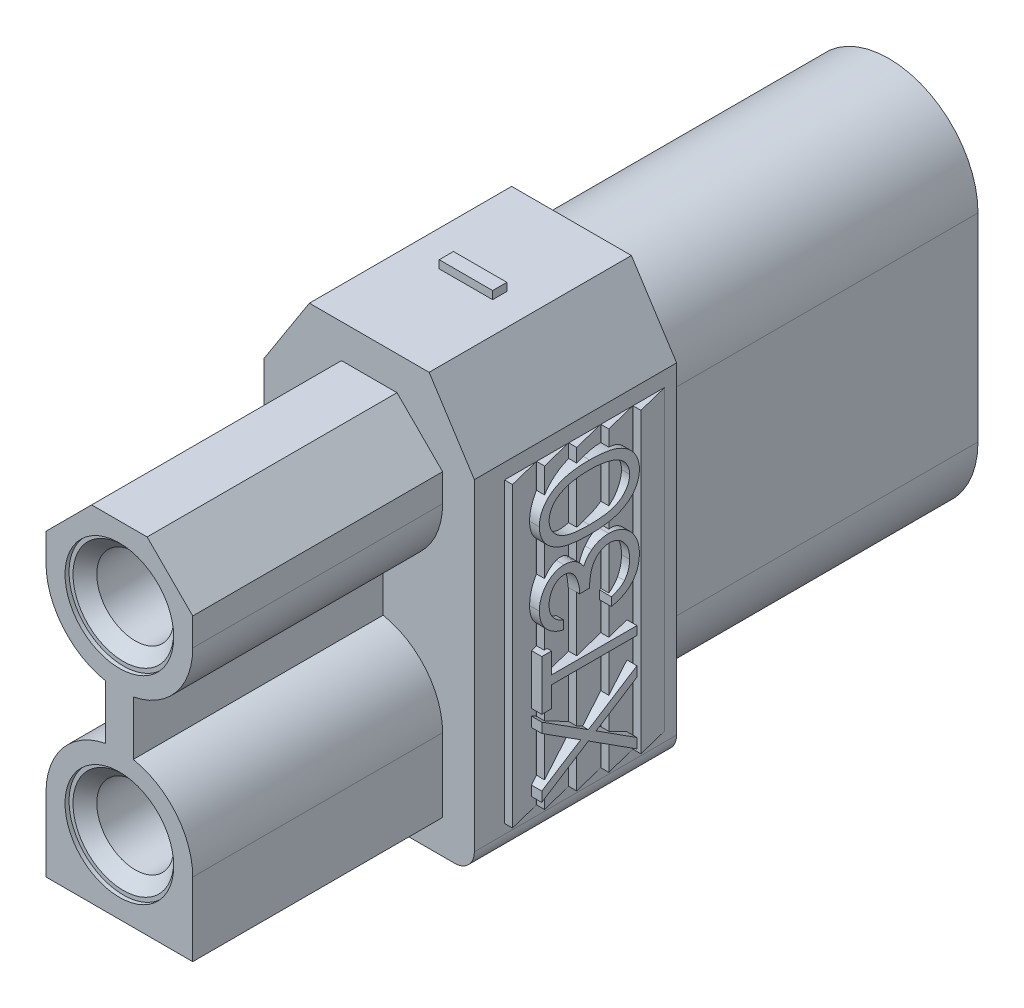
from build123d import *

# Parameters (mm, degrees)
BOSS_EXTRUDE2_DEPTH        = 5.1
BOSS_EXTRUDE3_START        = 1.45
BOSS_EXTRUDE3_DEPTH        = 3.65
BOSS_EXTRUDE4_START        = 1
BOSS_EXTRUDE4_DEPTH        = 7.5
BOSS_EXTRUDE5_DEPTH        = 5.1
BOSS_EXTRUDE5_DEPTH_BACK   = 3.45
SKETCH7_R                  = 1.1
BOSS_EXTRUDE5_2_DEPTH      = 5.1
BOSS_EXTRUDE5_2_DEPTH_BACK = 3.45
SKETCH8_R                  = 0.65
CUT_EXTRUDE1_DEPTH         = 3
CUT_EXTRUDE2_DEPTH         = 13.156309846
CUT_EXTRUDE2_DEPTH_BACK    = 13.156309846
SKETCH9_W                  = 1.9
SKETCH9_H                  = 1.1
SKETCH9_W_2                = 1.75
CHAMFER1_SIZE              = 0.65
CHAMFER3_SIZE              = 0.65
SKETCH10_R                 = 1.37
SKETCH10_R_2               = 0.97
BOSS_EXTRUDE6_DEPTH        = 6.2
BOSS_EXTRUDE6_2_DEPTH      = 6.2
BOSS_EXTRUDE7_DEPTH        = 0.2
SKETCH13_W                 = 1.346153847
SKETCH13_H                 = 0.358974359
BOSS_EXTRUDE8_DEPTH        = 0.2
BOSS_EXTRUDE9_DEPTH        = 0.3
BOSS_EXTRUDE10_DEPTH       = 0.3
CHAMFER4_SIZE              = 0.3
CHAMFER5_SIZE              = 0.3
SKETCH17_R                 = 1.37
BOSS_EXTRUDE11_DEPTH       = 6.3
BOSS_EXTRUDE11_2_DEPTH     = 6.3
SKETCH18_W                 = 0.7
SKETCH18_H                 = 1.720139453
BOSS_EXTRUDE12_DEPTH       = 6.3
BOSS_EXTRUDE13_DEPTH       = 8


with BuildPart() as part:
    # Sketch3 → Boss-Extrude2 (new body)
    with BuildSketch(Plane.XY):
        with BuildLine():
            Line((2.15, 0.260364397), (-2.15, 0.260364397))
            ThreePointArc((-2.15, 0.260364397), (-2.503553391, 0.406811006), (-2.65, 0.760364397))
            Line((-2.65, 0.760364397), (-2.65, 8.886196367))
            Line((-2.65, 8.886196367), (-1.509463409, 10.660364397))
            Line((-1.509463409, 10.660364397), (1.509463409, 10.660364397))
            Line((1.509463409, 10.660364397), (2.65, 8.886196367))
            Line((2.65, 8.886196367), (2.65, 0.760364397))
            ThreePointArc((2.65, 0.760364397), (2.503553391, 0.406811006), (2.15, 0.260364397))
        make_face()
        Polygon((1.9, 1.010364397), (-1.9, 1.010364397), (-1.9, 8.665919952), (-1.1, 9.910364397), (1.1, 9.910364397), (1.9, 8.665919952), align=None, mode=Mode.SUBTRACT)
    extrude(amount=BOSS_EXTRUDE2_DEPTH)

    # Sketch4 → Boss-Extrude3 (add)
    with BuildSketch(Plane.XY.offset(BOSS_EXTRUDE3_START)):
        with BuildLine():
            Line((-1.5, 10.010364397), (1.4, 10.010364397))
            ThreePointArc((1.4, 10.010364397), (1.753553391, 9.863917787), (1.9, 9.510364397))
            Line((1.9, 9.510364397), (1.9, 1.010364397))
            Line((1.9, 1.010364397), (-2, 1.010364397))
            Line((-2, 1.010364397), (-2, 9.510364397))
            ThreePointArc((-2, 9.510364397), (-1.853553391, 9.863917787), (-1.5, 10.010364397))
        make_face()
    extrude(amount=BOSS_EXTRUDE3_DEPTH)

    # Sketch6 → Boss-Extrude4 (add)
    with BuildSketch(Plane(origin=(0, 0, 0), x_dir=(1, 0, 0), z_dir=(0, 1, 0)).offset(BOSS_EXTRUDE4_START)):
        Polygon((2.65, -0.3), (2.65, -1.1), (2.85, -1.1), align=None)
        Polygon((2.65, -1.11), (2.65, -1.91), (2.85, -1.91), align=None)
        Polygon((2.65, -1.92), (2.65, -2.72), (2.85, -2.72), align=None)
        Polygon((2.65, -2.73), (2.65, -3.53), (2.85, -3.53), align=None)
        Polygon((2.65, -3.54), (2.65, -4.34), (2.85, -4.34), align=None)
        Polygon((-2.85, -4.34), (-2.65, -3.54), (-2.65, -4.34), align=None)
        Polygon((-2.85, -3.53), (-2.65, -2.73), (-2.65, -3.53), align=None)
        Polygon((-2.85, -2.72), (-2.65, -1.92), (-2.65, -2.72), align=None)
        Polygon((-2.85, -1.91), (-2.65, -1.11), (-2.65, -1.91), align=None)
        Polygon((-2.85, -1.1), (-2.65, -0.3), (-2.65, -1.1), align=None)
    extrude(amount=BOSS_EXTRUDE4_DEPTH)

    # Sketch12 → Boss-Extrude7 (add)
    with BuildSketch(Plane.XZ.offset(-0.260364397)):
        Polygon((-0.148717949, 2.884615385), (-0.148717949, 3.916666667), (0.165384615, 3.916666667), (0.165384615, 2.884615385), (1.197435897, 2.884615385), (1.197435897, 2.570512821), (0.165384615, 2.570512821), (0.165384615, 1.538461538), (-0.148717949, 1.538461538), (-0.148717949, 2.570512821), (-1.180769231, 2.570512821), (-1.180769231, 2.884615385), align=None)
    extrude(amount=BOSS_EXTRUDE7_DEPTH)

    # Sketch13 → Boss-Extrude8 (add)
    with BuildSketch(Plane(origin=(0, 10.660364397, 0), x_dir=(-1, 0, 0), z_dir=(0, 1, 0))):
        with Locations((-0.052168047, 2.534824587)):
            Rectangle(SKETCH13_W, SKETCH13_H)
    extrude(amount=BOSS_EXTRUDE8_DEPTH)

    # Sketch14 → Boss-Extrude9 (add)
    # profile 1 of 4: a face of its own
    with BuildSketch(Plane.ZY.offset(2.65)):
        Polygon((3.7, 8.211538462), (3.7, 7.962980769), (2.718269231, 7.334615385), (3.7, 6.70625), (3.7, 6.457692308), (2.524038462, 7.210096154), (1.3, 6.426923077), (1.3, 6.675480769), (2.329807692, 7.334615385), (1.3, 7.99375), (1.3, 8.242307692), (2.524038462, 7.458653846), align=None)
    # profile 2 of 4: a face of its own
    with BuildSketch(Plane.ZY.offset(2.65)):
        Polygon((3.453846154, 6.288461538), (3.7, 6.288461538), (3.7, 5.026923077), (3.453846154, 5.026923077), (3.453846154, 5.55), (1.3, 5.55), (1.3, 5.765384615), (3.453846154, 5.765384615), align=None)
    # profile 3 of 4: a face of its own
    with BuildSketch(Plane.ZY.offset(2.65)):
        with BuildLine():
            Line((3.146153846, 4.503846154), (3.146153846, 4.719230769))
            add(Edge.make_bspline(
                [(3.146153846, 4.719230769), (3.170313264, 4.713395649), (3.217542949, 4.701988466), (3.285022214, 4.678195844), (3.348878343, 4.652276354), (3.40791565, 4.621152397), (3.463320612, 4.587203537), (3.513836583, 4.548307957), (3.560748331, 4.506260147), (3.602380265, 4.45975161), (3.64007928, 4.410977671), (3.672222176, 4.359251074), (3.699873024, 4.305612519), (3.722652611, 4.24969037), (3.73981297, 4.191318138), (3.752263351, 4.131023539), (3.760348687, 4.068648568), (3.761137781, 4.026307363), (3.761538462, 4.004807692)],
                knots=[0, 0, 0, 0, 1.162005537, 2.271625781, 3.343758855, 4.383309926, 5.390229558, 6.379919256, 7.361854164, 8.333198761, 9.295911338, 10.242430842, 11.177959212, 12.116337295, 13.062827104, 14.020064771, 14.994644689, 16, 16, 16, 16], degree=3))
            add(Edge.make_bspline(
                [(3.761538462, 4.004807692), (3.760592704, 3.973482383), (3.758721818, 3.911515062), (3.741637633, 3.820477544), (3.714603256, 3.732687725), (3.677249843, 3.649106526), (3.631178543, 3.57147103), (3.57634558, 3.502394787), (3.513808916, 3.442814094), (3.444735158, 3.392829378), (3.370914237, 3.353692236), (3.294936987, 3.324833008), (3.216983635, 3.307263856), (3.164350072, 3.304986903), (3.137980769, 3.303846154)],
                knots=[0, 0, 0, 0, 1.083050992, 2.142477498, 3.193116406, 4.255571735, 5.30263384, 6.308962982, 7.297363603, 8.282367274, 9.249857812, 10.179914175, 11.08814088, 12, 12, 12, 12], degree=3))
            add(Edge.make_bspline(
                [(3.137980769, 3.303846154), (3.112604681, 3.304644045), (3.062947616, 3.306205394), (2.990452875, 3.319462792), (2.922127206, 3.341773372), (2.85768298, 3.372678352), (2.797528805, 3.412683987), (2.741529337, 3.461145264), (2.689436199, 3.518404233), (2.659594275, 3.561795504), (2.644230769, 3.584134615)],
                knots=[0, 0, 0, 0, 1.024540389, 2.004866551, 2.965041327, 3.920577974, 4.882998113, 5.874504559, 6.905732034, 8, 8, 8, 8], degree=3))
            add(Edge.make_bspline(
                [(2.644230769, 3.584134615), (2.63190288, 3.558604269), (2.607477766, 3.50802127), (2.559576676, 3.439072335), (2.504269466, 3.376481792), (2.46110879, 3.341576385), (2.439423077, 3.324038462)],
                knots=[0, 0, 0, 0, 1.015518401, 2.012035669, 3.001164323, 4, 4, 4, 4], degree=3))
            add(Edge.make_bspline(
                [(2.439423077, 3.324038462), (2.423613732, 3.312485412), (2.392253932, 3.289568501), (2.341804337, 3.261361383), (2.290962579, 3.235479451), (2.237729623, 3.216431099), (2.183815408, 3.199993125), (2.128065414, 3.189177486), (2.071009313, 3.182234278), (2.032392143, 3.18125931), (2.012980769, 3.180769231)],
                knots=[0, 0, 0, 0, 1.02516404, 2.033540309, 3.025129118, 4.011046665, 4.991655828, 5.976607087, 6.982917762, 8, 8, 8, 8], degree=3))
            add(Edge.make_bspline(
                [(2.012980769, 3.180769231), (1.97937544, 3.182002464), (1.912322928, 3.184463127), (1.813234502, 3.206368134), (1.716541423, 3.240522701), (1.623676369, 3.288177011), (1.536970145, 3.347137911), (1.45974361, 3.417672544), (1.39291464, 3.498066224), (1.33725751, 3.587792791), (1.292734208, 3.684961717), (1.261839895, 3.788901588), (1.241716319, 3.898100993), (1.239558549, 3.972986084), (1.238461538, 4.011057692)],
                knots=[0, 0, 0, 0, 0.95570045, 1.906903359, 2.87519758, 3.868912786, 4.869932978, 5.851730567, 6.836639976, 7.83677598, 8.849487602, 9.869908895, 10.917060885, 12, 12, 12, 12], degree=3))
            add(Edge.make_bspline(
                [(1.238461538, 4.011057692), (1.239056885, 4.036716641), (1.240228328, 4.087204896), (1.248236511, 4.161429009), (1.262862801, 4.232278174), (1.282545067, 4.299848184), (1.307499405, 4.364199066), (1.338575083, 4.425134453), (1.375131542, 4.483029237), (1.417600288, 4.537337089), (1.465107492, 4.588051536), (1.518496527, 4.633824832), (1.576780462, 4.675420119), (1.640636272, 4.711723643), (1.709238734, 4.744388981), (1.783466275, 4.771255923), (1.862655319, 4.79490317), (1.917840055, 4.805897546), (1.946153846, 4.811538462)],
                knots=[0, 0, 0, 0, 1.048658725, 2.063410685, 3.046034179, 4.001477787, 4.936774919, 5.862367409, 6.792675028, 7.730719943, 8.675894397, 9.627829632, 10.600096036, 11.597688215, 12.626045268, 13.701542398, 14.82072376, 16, 16, 16, 16], degree=3))
            Line((1.946153846, 4.811538462), (1.946153846, 4.596153846))
            add(Edge.make_bspline(
                [(1.946153846, 4.596153846), (1.927674523, 4.590542446), (1.891730634, 4.579627786), (1.840000138, 4.561048839), (1.792577473, 4.539882024), (1.749114761, 4.517174898), (1.709183971, 4.493326821), (1.673840975, 4.466642301), (1.641533408, 4.439097744), (1.623331388, 4.418334759), (1.614423077, 4.408173077)],
                knots=[0, 0, 0, 0, 1.198163088, 2.33053128, 3.407730985, 4.417276592, 5.372219308, 6.28897303, 7.162600585, 8, 8, 8, 8], degree=3))
            add(Edge.make_bspline(
                [(1.614423077, 4.408173077), (1.604063077, 4.394735424), (1.583375055, 4.367901598), (1.556973938, 4.324174811), (1.534097806, 4.278187461), (1.516623272, 4.228943113), (1.501827162, 4.177504413), (1.49214452, 4.123039934), (1.485501203, 4.066030185), (1.484914964, 4.027103719), (1.484615385, 4.007211538)],
                knots=[0, 0, 0, 0, 0.946170439, 1.889420265, 2.845303464, 3.807233317, 4.801018734, 5.828864929, 6.890507805, 8, 8, 8, 8], degree=3))
            add(Edge.make_bspline(
                [(1.484615385, 4.007211538), (1.485037033, 3.98475169), (1.485861529, 3.940833395), (1.493465896, 3.87675431), (1.504492464, 3.815774027), (1.521740161, 3.758514848), (1.542431622, 3.704197617), (1.569520542, 3.654034852), (1.600113099, 3.606551829), (1.635698125, 3.563139581), (1.674161687, 3.524001317), (1.714968099, 3.490181532), (1.756852096, 3.460889731), (1.800790747, 3.437344011), (1.846353049, 3.418718241), (1.893709543, 3.406046248), (1.942461457, 3.397233195), (1.975601388, 3.396515597), (1.992307692, 3.396153846)],
                knots=[0, 0, 0, 0, 1.216990249, 2.379719373, 3.493992396, 4.571561497, 5.616923107, 6.638958652, 7.655775068, 8.674704564, 9.676001865, 10.625896028, 11.54399481, 12.441854662, 13.322657739, 14.20572845, 15.095482574, 16, 16, 16, 16], degree=3))
            add(Edge.make_bspline(
                [(1.992307692, 3.396153846), (2.014669779, 3.397203177), (2.05928268, 3.399296618), (2.12491721, 3.415279923), (2.188157598, 3.441568341), (2.247915784, 3.478376614), (2.303327092, 3.523161948), (2.352574163, 3.575490823), (2.393618756, 3.635491603), (2.421872315, 3.691070581), (2.440702124, 3.740419384), (2.453905233, 3.782567182), (2.464459565, 3.829794668), (2.474668782, 3.881534884), (2.483227542, 3.938006046), (2.490395838, 3.99925903), (2.496122592, 4.065318479), (2.498681403, 4.111049473), (2.5, 4.134615385)],
                knots=[0, 0, 0, 0, 1.070481957, 2.135637345, 3.216366529, 4.339485895, 5.485746587, 6.620975969, 7.768829582, 8.956804399, 9.598399438, 10.297751078, 11.070570279, 11.915248466, 12.824061284, 13.805856426, 14.869322739, 16, 16, 16, 16], degree=3))
            Line((2.5, 4.134615385), (2.746153846, 4.134615385))
            add(Edge.make_bspline(
                [(2.746153846, 4.134615385), (2.746659909, 4.104923977), (2.74765116, 4.046765804), (2.759557156, 3.961798157), (2.776212077, 3.880451678), (2.801133952, 3.804583191), (2.831047314, 3.735657242), (2.864776815, 3.675530146), (2.902990827, 3.62562689), (2.945187826, 3.585822797), (2.990973089, 3.556608006), (3.038193773, 3.534679412), (3.087948546, 3.521823981), (3.121884535, 3.520098217), (3.138942308, 3.519230769)],
                knots=[0, 0, 0, 0, 1.321708579, 2.588902423, 3.815526512, 5.016621128, 6.138757764, 7.158873101, 8.079948563, 8.928590313, 9.728601868, 10.489025425, 11.240515403, 12, 12, 12, 12], degree=3))
            add(Edge.make_bspline(
                [(3.138942308, 3.519230769), (3.151475649, 3.519514904), (3.176410136, 3.520080176), (3.212838313, 3.527210223), (3.248154898, 3.537922039), (3.282199645, 3.552657938), (3.314774944, 3.572345731), (3.345920757, 3.59597764), (3.376159056, 3.623565073), (3.404043204, 3.655829025), (3.430345097, 3.690758195), (3.453082104, 3.728681243), (3.472353977, 3.768761731), (3.488276651, 3.811036515), (3.500246646, 3.855674947), (3.508843236, 3.902458453), (3.514217465, 3.951478695), (3.514991259, 3.984922153), (3.515384615, 4.001923077)],
                knots=[0, 0, 0, 0, 0.884317272, 1.759307272, 2.611736065, 3.488921043, 4.37244062, 5.294096728, 6.247679003, 7.258495569, 8.302441962, 9.333537773, 10.376747089, 11.440883505, 12.520330301, 13.637364711, 14.798958396, 16, 16, 16, 16], degree=3))
            add(Edge.make_bspline(
                [(3.515384615, 4.001923077), (3.514432389, 4.029250838), (3.51257247, 4.082628311), (3.496224619, 4.159563101), (3.470323134, 4.231010572), (3.439047168, 4.285439132), (3.408279997, 4.325699299), (3.381810999, 4.355020423), (3.351800577, 4.383288989), (3.317425578, 4.409395714), (3.27986802, 4.434904968), (3.238921049, 4.459573177), (3.194000885, 4.482607996), (3.162411731, 4.496629667), (3.146153846, 4.503846154)],
                knots=[0, 0, 0, 0, 1.4727372, 2.876598283, 4.222346151, 5.558423782, 6.24313385, 6.953189256, 7.68715613, 8.463578749, 9.278833271, 10.135787152, 11.040551781, 12, 12, 12, 12], degree=3))
        make_face()
    # profile 4 of 4: a face of its own
    with BuildSketch(Plane.ZY.offset(2.65)):
        with BuildLine():
            add(Edge.make_bspline(
                [(2.499038462, 2.965384615), (2.537505242, 2.965159689), (2.612227517, 2.964722765), (2.721108414, 2.959862134), (2.823252613, 2.951787614), (2.918664999, 2.940721985), (3.007370214, 2.927255947), (3.089131173, 2.909279594), (3.164326392, 2.888836595), (3.233200736, 2.865143267), (3.296683291, 2.838409551), (3.355943811, 2.809309064), (3.410907058, 2.776702805), (3.462398728, 2.742398603), (3.509844149, 2.705142892), (3.553153471, 2.665328627), (3.592352846, 2.622560867), (3.627908811, 2.577685461), (3.658882589, 2.530418809), (3.686792023, 2.482217984), (3.709699001, 2.432232443), (3.728521186, 2.380918072), (3.743602926, 2.328424096), (3.754047002, 2.274533615), (3.760592629, 2.219233611), (3.761220193, 2.181909617), (3.761538462, 2.162980769)],
                knots=[0, 0, 0, 0, 1.646377244, 3.198111528, 4.663803227, 6.031090796, 7.308794487, 8.502186765, 9.612154809, 10.642545331, 11.617106989, 12.558866172, 13.465886467, 14.35053239, 15.20542558, 16.045215227, 16.865619885, 17.686225247, 18.492864914, 19.282407821, 20.068097601, 20.842842034, 21.620163247, 22.403093475, 23.190129512, 24, 24, 24, 24], degree=3))
            add(Edge.make_bspline(
                [(3.761538462, 2.162980769), (3.76120396, 2.143893584), (3.760538741, 2.105935178), (3.75414518, 2.049816063), (3.74353641, 1.994993425), (3.728504885, 1.941700987), (3.709856421, 1.889500996), (3.686482397, 1.838801745), (3.659274031, 1.789288317), (3.627303373, 1.741747549), (3.591658383, 1.695657527), (3.551363982, 1.652150352), (3.506827031, 1.611222065), (3.458524039, 1.572358998), (3.405528552, 1.536663732), (3.348762306, 1.502670521), (3.28723257, 1.472243982), (3.221965963, 1.442940205), (3.151156597, 1.417646271), (3.075203618, 1.394835131), (2.99320989, 1.376403839), (2.905605608, 1.361051195), (2.812069048, 1.349157552), (2.712800717, 1.340495169), (2.607735307, 1.335919339), (2.535901353, 1.335057601), (2.499038462, 1.334615385)],
                knots=[0, 0, 0, 0, 0.810914788, 1.612654377, 2.396697861, 3.181598691, 3.963628158, 4.749916497, 5.551656086, 6.361998678, 7.18212741, 8.025565596, 8.878627764, 9.750805457, 10.657531673, 11.591944965, 12.560506719, 13.57287815, 14.630710178, 15.753379473, 16.941251878, 18.199788006, 19.531962791, 20.947069417, 22.433333509, 24, 24, 24, 24], degree=3))
            add(Edge.make_bspline(
                [(2.499038462, 1.334615385), (2.46233649, 1.335062738), (2.390824197, 1.335934387), (2.286229632, 1.340437871), (2.187494777, 1.349350593), (2.094344793, 1.360374224), (2.00733274, 1.376077235), (1.925631239, 1.393928791), (1.849945361, 1.416116359), (1.779509438, 1.441065535), (1.714562595, 1.46973345), (1.653564755, 1.500428903), (1.596844827, 1.534213456), (1.543850111, 1.570121601), (1.495128206, 1.608654337), (1.450558698, 1.649755931), (1.410170985, 1.69345767), (1.374038974, 1.739651897), (1.342440476, 1.787940548), (1.314196501, 1.837288706), (1.291278267, 1.888681315), (1.271927958, 1.940976215), (1.256861852, 1.994666843), (1.246546191, 2.049700536), (1.239291373, 2.105897061), (1.238739108, 2.14388698), (1.238461538, 2.162980769)],
                knots=[0, 0, 0, 0, 1.56130642, 3.042141888, 4.451772327, 5.777565838, 7.030558081, 8.211376819, 9.333164717, 10.383253789, 11.387583522, 12.350962576, 13.286244149, 14.193812918, 15.072134482, 15.925989337, 16.770211267, 17.600669898, 18.417446232, 19.22325363, 20.01647746, 20.807971184, 21.593601364, 22.38506573, 23.188331689, 24, 24, 24, 24], degree=3))
            add(Edge.make_bspline(
                [(1.238461538, 2.162980769), (1.23878287, 2.181908848), (1.239416472, 2.219231325), (1.245917863, 2.274542438), (1.25651944, 2.328348871), (1.270916329, 2.380758187), (1.289213921, 2.431877644), (1.31248778, 2.481206477), (1.339481837, 2.529396148), (1.370192627, 2.576226767), (1.405386394, 2.620805771), (1.444309654, 2.663388571), (1.487938683, 2.702899968), (1.535575131, 2.739688746), (1.586814803, 2.7745993), (1.642162448, 2.806886042), (1.701978203, 2.835929766), (1.765811202, 2.863262607), (1.835191738, 2.887356454), (1.910788018, 2.908478489), (1.993018222, 2.926086659), (2.081638235, 2.940247241), (2.176714385, 2.951921216), (2.278414071, 2.9598239), (2.38664955, 2.964726636), (2.460891856, 2.965161287), (2.499038462, 2.965384615)],
                knots=[0, 0, 0, 0, 0.810940842, 1.599017053, 2.38298203, 3.159479784, 3.926441347, 4.70693857, 5.494146311, 6.292334103, 7.104379492, 7.925868426, 8.762126819, 9.623561095, 10.503686106, 11.41783325, 12.366995289, 13.351843594, 14.392337808, 15.512229747, 16.713911458, 17.994391108, 19.357476964, 20.818259213, 22.365182633, 24, 24, 24, 24], degree=3))
        make_face()
        with BuildLine():
            add(Edge.make_bspline(
                [(2.5, 2.75), (2.467943749, 2.749918093), (2.405728861, 2.749759129), (2.315322054, 2.745606306), (2.230999542, 2.739949004), (2.152654262, 2.732652113), (2.080551391, 2.721815812), (2.014195056, 2.709673993), (1.953936316, 2.69489823), (1.899362024, 2.677415701), (1.849544813, 2.657503965), (1.803192165, 2.635760049), (1.759742093, 2.612413867), (1.719635907, 2.586240321), (1.682474377, 2.557833083), (1.648364296, 2.527145508), (1.617454495, 2.494231565), (1.580777019, 2.448667879), (1.542427413, 2.388811558), (1.509443824, 2.313008014), (1.488581598, 2.235082492), (1.485935923, 2.182176334), (1.484615385, 2.155769231)],
                knots=[0, 0, 0, 0, 1.459116078, 2.831857795, 4.118796693, 5.306371758, 6.412361096, 7.436813035, 8.376339383, 9.234574298, 10.043323891, 10.816788787, 11.564361537, 12.286735248, 12.994408768, 13.691741332, 14.372975427, 15.047457468, 16.352811911, 17.594285292, 18.799233213, 20, 20, 20, 20], degree=3))
            add(Edge.make_bspline(
                [(1.484615385, 2.155769231), (1.485711006, 2.129192542), (1.487899986, 2.076094034), (1.50901912, 1.998516575), (1.540883947, 1.92320439), (1.578562237, 1.864183631), (1.61444452, 1.819281315), (1.645037421, 1.787109665), (1.679292873, 1.757581403), (1.71625239, 1.729575409), (1.756622094, 1.703889185), (1.80020786, 1.680531605), (1.847130725, 1.65921731), (1.879887117, 1.647073964), (1.896634615, 1.640865385)],
                knots=[0, 0, 0, 0, 1.353760809, 2.704726607, 4.075137775, 5.516104923, 6.260822281, 7.007110065, 7.778089737, 8.566572457, 9.372053459, 10.217411131, 11.088608312, 12, 12, 12, 12], degree=3))
            add(Edge.make_bspline(
                [(1.896634615, 1.640865385), (1.918049294, 1.633629887), (1.961530275, 1.618938723), (2.028979636, 1.600004935), (2.099747246, 1.585093804), (2.173410183, 1.571678925), (2.250511692, 1.562522543), (2.330813213, 1.555152614), (2.41437529, 1.550811572), (2.471148998, 1.550273457), (2.5, 1.55)],
                knots=[0, 0, 0, 0, 0.884706709, 1.796334032, 2.740027952, 3.714592787, 4.726048262, 5.777819803, 6.87074269, 8, 8, 8, 8], degree=3))
            add(Edge.make_bspline(
                [(2.5, 1.55), (2.528850382, 1.550301594), (2.585294877, 1.550891648), (2.667873225, 1.55476836), (2.746441917, 1.560997914), (2.821072227, 1.569429478), (2.891631323, 1.581004233), (2.958220173, 1.594904362), (3.020820825, 1.611200667), (3.079594722, 1.629893016), (3.134330614, 1.650959034), (3.185147673, 1.674230668), (3.2323153, 1.699064654), (3.275698105, 1.726043141), (3.315491909, 1.754839941), (3.350898473, 1.786216607), (3.383015255, 1.818928162), (3.419675301, 1.864745666), (3.45705475, 1.924728034), (3.491454128, 1.99936505), (3.511208386, 2.077036348), (3.513993543, 2.12954386), (3.515384615, 2.155769231)],
                knots=[0, 0, 0, 0, 1.313668642, 2.570134578, 3.763346207, 4.902004944, 5.98888779, 7.017888835, 7.998425394, 8.933058446, 9.82474457, 10.667209444, 11.476765193, 12.250262638, 12.991704352, 13.7104269, 14.401925311, 15.076585796, 16.378385137, 17.609787933, 18.806186071, 20, 20, 20, 20], degree=3))
            add(Edge.make_bspline(
                [(3.515384615, 2.155769231), (3.513993418, 2.182314751), (3.511208489, 2.235454152), (3.491505929, 2.313915865), (3.457375016, 2.389084556), (3.419433917, 2.448585691), (3.383664241, 2.494345387), (3.352558795, 2.526658121), (3.318345526, 2.556867163), (3.281341328, 2.585298067), (3.241214914, 2.611446417), (3.197771161, 2.634802154), (3.151414205, 2.656533589), (3.101608328, 2.676488074), (3.046951763, 2.693808585), (2.986997143, 2.709289928), (2.920578828, 2.72142438), (2.848274376, 2.732013417), (2.769832785, 2.740086958), (2.68531587, 2.745591783), (2.594752721, 2.749766643), (2.53221683, 2.749920656), (2.5, 2.75)],
                knots=[0, 0, 0, 0, 1.207964612, 2.418129846, 3.655795183, 4.951004962, 5.620895151, 6.296795572, 6.989224116, 7.696855977, 8.419187164, 9.166715907, 9.940135271, 10.748837255, 11.607021648, 12.548275234, 13.5654991, 14.678641405, 15.874140913, 17.15372626, 18.533675393, 20, 20, 20, 20], degree=3))
        make_face(mode=Mode.SUBTRACT)
    extrude(amount=BOSS_EXTRUDE9_DEPTH)

    # Sketch15 → Boss-Extrude10 (add)
    # profile 1 of 4: a face of its own
    with BuildSketch(Plane(origin=(2.65, 0, 0), x_dir=(0, 0, -1), z_dir=(1, 0, 0))):
        Polygon((-3.7, 1.288461538), (-3.7, 1.537019231), (-2.718269231, 2.165384615), (-3.7, 2.79375), (-3.7, 3.042307692), (-2.524038462, 2.289903846), (-1.3, 3.073076923), (-1.3, 2.824519231), (-2.329807692, 2.165384615), (-1.3, 1.50625), (-1.3, 1.257692308), (-2.524038462, 2.041346154), align=None)
    # profile 2 of 4: a face of its own
    with BuildSketch(Plane(origin=(2.65, 0, 0), x_dir=(0, 0, -1), z_dir=(1, 0, 0))):
        Polygon((-3.453846154, 3.211538462), (-3.7, 3.211538462), (-3.7, 4.473076923), (-3.453846154, 4.473076923), (-3.453846154, 3.95), (-1.3, 3.95), (-1.3, 3.734615385), (-3.453846154, 3.734615385), align=None)
    # profile 3 of 4: a face of its own
    with BuildSketch(Plane(origin=(2.65, 0, 0), x_dir=(0, 0, -1), z_dir=(1, 0, 0))):
        with BuildLine():
            Line((-3.146153846, 4.996153846), (-3.146153846, 4.780769231))
            add(Edge.make_bspline(
                [(-3.146153846, 4.780769231), (-3.170313264, 4.786604351), (-3.217542949, 4.798011534), (-3.285022214, 4.821804156), (-3.348878343, 4.847723646), (-3.40791565, 4.878847603), (-3.463320612, 4.912796463), (-3.513836583, 4.951692043), (-3.560748331, 4.993739853), (-3.602380265, 5.04024839), (-3.64007928, 5.089022329), (-3.672222176, 5.140748926), (-3.699873024, 5.194387481), (-3.722652611, 5.25030963), (-3.73981297, 5.308681862), (-3.752263351, 5.368976461), (-3.760348687, 5.431351432), (-3.761137781, 5.473692637), (-3.761538462, 5.495192308)],
                knots=[0, 0, 0, 0, 1.162005537, 2.271625781, 3.343758855, 4.383309926, 5.390229558, 6.379919256, 7.361854164, 8.333198761, 9.295911338, 10.242430842, 11.177959212, 12.116337295, 13.062827104, 14.020064771, 14.994644689, 16, 16, 16, 16], degree=3))
            add(Edge.make_bspline(
                [(-3.761538462, 5.495192308), (-3.760592704, 5.526517617), (-3.758721818, 5.588484938), (-3.741637633, 5.679522456), (-3.714603256, 5.767312275), (-3.677249843, 5.850893474), (-3.631178543, 5.92852897), (-3.57634558, 5.997605213), (-3.513808916, 6.057185906), (-3.444735158, 6.107170622), (-3.370914237, 6.146307764), (-3.294936987, 6.175166992), (-3.216983635, 6.192736144), (-3.164350072, 6.195013097), (-3.137980769, 6.196153846)],
                knots=[0, 0, 0, 0, 1.083050992, 2.142477498, 3.193116406, 4.255571735, 5.30263384, 6.308962982, 7.297363603, 8.282367274, 9.249857812, 10.179914175, 11.08814088, 12, 12, 12, 12], degree=3))
            add(Edge.make_bspline(
                [(-3.137980769, 6.196153846), (-3.112604681, 6.195355955), (-3.062947616, 6.193794606), (-2.990452875, 6.180537208), (-2.922127206, 6.158226628), (-2.85768298, 6.127321648), (-2.797528805, 6.087316013), (-2.741529337, 6.038854736), (-2.689436199, 5.981595767), (-2.659594275, 5.938204496), (-2.644230769, 5.915865385)],
                knots=[0, 0, 0, 0, 1.024540389, 2.004866551, 2.965041327, 3.920577974, 4.882998113, 5.874504559, 6.905732034, 8, 8, 8, 8], degree=3))
            add(Edge.make_bspline(
                [(-2.644230769, 5.915865385), (-2.631947571, 5.941428272), (-2.607571562, 5.992157828), (-2.559006904, 6.060606804), (-2.504311045, 6.12369148), (-2.461150573, 6.158459102), (-2.439423077, 6.175961538)],
                knots=[0, 0, 0, 0, 1.015663554, 2.015584519, 3.001021554, 4, 4, 4, 4], degree=3))
            add(Edge.make_bspline(
                [(-2.439423077, 6.175961538), (-2.423612047, 6.187509888), (-2.392248904, 6.210417473), (-2.341823927, 6.238693268), (-2.290840048, 6.264345232), (-2.237930741, 6.284333954), (-2.183709246, 6.299813177), (-2.12808246, 6.310877885), (-2.071004959, 6.317751581), (-2.032390687, 6.31873596), (-2.012980769, 6.319230769)],
                knots=[0, 0, 0, 0, 1.025084078, 2.033381695, 3.024893161, 4.013698104, 4.991890475, 5.976764909, 6.982997093, 8, 8, 8, 8], degree=3))
            add(Edge.make_bspline(
                [(-2.012980769, 6.319230769), (-1.979374275, 6.318000068), (-1.912319439, 6.315544458), (-1.813248482, 6.293601467), (-1.716418185, 6.259570588), (-1.623756647, 6.211297303), (-1.537142597, 6.152199607), (-1.459073945, 6.082668571), (-1.393021198, 6.001710161), (-1.337163761, 5.912258452), (-1.292929099, 5.814928886), (-1.261046363, 5.711252352), (-1.241923125, 5.601828841), (-1.239628538, 5.526999571), (-1.238461538, 5.488942308)],
                knots=[0, 0, 0, 0, 0.955697303, 1.906897079, 2.875188111, 3.870982192, 4.871999088, 5.854111427, 6.836107184, 7.836239895, 8.848948182, 9.870701427, 10.917064451, 12, 12, 12, 12], degree=3))
            add(Edge.make_bspline(
                [(-1.238461538, 5.488942308), (-1.239062077, 5.463284974), (-1.240243738, 5.412799897), (-1.248177969, 5.338552782), (-1.263063166, 5.267830621), (-1.281783363, 5.199946675), (-1.307666131, 5.135925478), (-1.338523186, 5.074846144), (-1.375145816, 5.016976404), (-1.41759561, 4.96265993), (-1.465111807, 4.91195475), (-1.518483783, 4.866152665), (-1.576715432, 4.824746924), (-1.640330558, 4.788000613), (-1.709150984, 4.755759082), (-1.783452485, 4.72871617), (-1.862659044, 4.705104367), (-1.917841318, 4.69410501), (-1.946153846, 4.688461538)],
                knots=[0, 0, 0, 0, 1.048603596, 2.063302207, 3.045874044, 3.999447474, 4.937100059, 5.862643889, 6.7929026, 7.7308982, 8.676022965, 9.627908155, 10.600123445, 11.591992905, 12.626222643, 13.701663232, 14.820785756, 16, 16, 16, 16], degree=3))
            Line((-1.946153846, 4.688461538), (-1.946153846, 4.903846154))
            add(Edge.make_bspline(
                [(-1.946153846, 4.903846154), (-1.927674523, 4.909457554), (-1.891730634, 4.920372214), (-1.840000138, 4.938951161), (-1.792577473, 4.960117976), (-1.749114761, 4.982825102), (-1.709183971, 5.006673179), (-1.673840975, 5.033357699), (-1.641533408, 5.060902256), (-1.623331388, 5.081665241), (-1.614423077, 5.091826923)],
                knots=[0, 0, 0, 0, 1.198163088, 2.33053128, 3.407730985, 4.417276592, 5.372219308, 6.28897303, 7.162600585, 8, 8, 8, 8], degree=3))
            add(Edge.make_bspline(
                [(-1.614423077, 5.091826923), (-1.604067348, 5.105266076), (-1.583387857, 5.1321029), (-1.556922628, 5.175807161), (-1.534269024, 5.221931471), (-1.515855225, 5.270860473), (-1.502033164, 5.322600731), (-1.492084694, 5.376942365), (-1.485517159, 5.433974536), (-1.48492036, 5.472897878), (-1.484615385, 5.492788462)],
                knots=[0, 0, 0, 0, 0.946083416, 1.889246487, 2.84504177, 3.809995578, 4.801312957, 5.829064617, 6.89060985, 8, 8, 8, 8], degree=3))
            add(Edge.make_bspline(
                [(-1.484615385, 5.492788462), (-1.48503772, 5.515248006), (-1.485863559, 5.559165707), (-1.49345833, 5.623249039), (-1.504519185, 5.684214146), (-1.521602373, 5.741384152), (-1.542709242, 5.795507929), (-1.569211006, 5.845826774), (-1.60030453, 5.893001247), (-1.635645667, 5.936427125), (-1.674334692, 5.975475473), (-1.714800798, 6.009856853), (-1.756873367, 6.039085193), (-1.800785221, 6.062662504), (-1.846354521, 6.081280024), (-1.893709147, 6.093954218), (-1.942461558, 6.102766686), (-1.975601422, 6.103484363), (-1.992307692, 6.103846154)],
                knots=[0, 0, 0, 0, 1.217147791, 2.380027433, 3.494444702, 4.572153297, 5.609568379, 6.639424714, 7.649109417, 8.668170816, 9.669597737, 10.625200337, 11.543417969, 12.441394052, 13.322311151, 14.205496177, 15.095365482, 16, 16, 16, 16], degree=3))
            add(Edge.make_bspline(
                [(-1.992307692, 6.103846154), (-2.014668323, 6.102794596), (-2.059278321, 6.100696713), (-2.124934651, 6.084746761), (-2.18821688, 6.058275185), (-2.248305389, 6.021942445), (-2.303316966, 5.976632765), (-2.352751361, 5.924488333), (-2.39350346, 5.864090554), (-2.421685413, 5.808542998), (-2.440909842, 5.759331314), (-2.453715767, 5.717218212), (-2.464559344, 5.670070734), (-2.474647781, 5.618459552), (-2.483233842, 5.561995623), (-2.490393946, 5.500740468), (-2.496123116, 5.43468166), (-2.498681582, 5.388950575), (-2.5, 5.365384615)],
                knots=[0, 0, 0, 0, 1.070505987, 2.135685285, 3.216438728, 4.346150463, 5.486482244, 6.621737109, 7.7759408, 8.963942283, 9.59839197, 10.305095457, 11.070459627, 11.915156775, 12.823989992, 13.805807174, 14.869297358, 16, 16, 16, 16], degree=3))
            Line((-2.5, 5.365384615), (-2.746153846, 5.365384615))
            add(Edge.make_bspline(
                [(-2.746153846, 5.365384615), (-2.746730338, 5.395066113), (-2.747859148, 5.453184545), (-2.758772232, 5.538305504), (-2.776292024, 5.619355998), (-2.801324781, 5.695170906), (-2.830810345, 5.764140042), (-2.864880102, 5.82421666), (-2.903441563, 5.873819218), (-2.945756429, 5.913465928), (-2.990892973, 5.943600213), (-3.038225163, 5.96527192), (-3.08794064, 5.978188277), (-3.12188189, 5.979905883), (-3.138942308, 5.980769231)],
                knots=[0, 0, 0, 0, 1.322091412, 2.58874672, 3.817242262, 5.011895168, 6.140903042, 7.155122731, 8.080855046, 8.929742606, 9.727943956, 10.488587771, 11.240295418, 12, 12, 12, 12], degree=3))
            add(Edge.make_bspline(
                [(-3.138942308, 5.980769231), (-3.151477704, 5.980491282), (-3.176416281, 5.979938317), (-3.212965293, 5.972687545), (-3.248395398, 5.962292795), (-3.282302632, 5.947200869), (-3.314756392, 5.927646943), (-3.346112693, 5.904061066), (-3.375966368, 5.875771032), (-3.404471434, 5.844085888), (-3.430403155, 5.809000096), (-3.453097703, 5.771332087), (-3.472349685, 5.731234601), (-3.488277828, 5.68896449), (-3.500246317, 5.644324772), (-3.508843329, 5.597541626), (-3.514217441, 5.548521284), (-3.514991251, 5.51507784), (-3.515384615, 5.498076923)],
                knots=[0, 0, 0, 0, 0.884325644, 1.759323928, 2.622595547, 3.489424008, 4.37295195, 5.294616785, 6.255907374, 7.274251867, 8.302369084, 9.333474657, 10.37669385, 11.44084034, 12.520297356, 13.637342342, 14.798947025, 16, 16, 16, 16], degree=3))
            add(Edge.make_bspline(
                [(-3.515384615, 5.498076923), (-3.514430539, 5.470750065), (-3.512567005, 5.417374355), (-3.496244938, 5.340426984), (-3.470202824, 5.268893726), (-3.439117325, 5.214215783), (-3.408431313, 5.173839161), (-3.381631962, 5.144986404), (-3.351849455, 5.116652339), (-3.317249426, 5.090701018), (-3.280175056, 5.064456005), (-3.238741674, 5.040562592), (-3.194030089, 5.017344517), (-3.162421654, 5.003354197), (-3.146153846, 4.996153846)],
                knots=[0, 0, 0, 0, 1.472543308, 2.876219568, 4.221790263, 5.565193594, 6.249813518, 6.953379497, 7.687249741, 8.463570142, 9.283606569, 10.136032583, 11.040678096, 12, 12, 12, 12], degree=3))
        make_face()
    # profile 4 of 4: a face of its own
    with BuildSketch(Plane(origin=(2.65, 0, 0), x_dir=(0, 0, -1), z_dir=(1, 0, 0))):
        with BuildLine():
            add(Edge.make_bspline(
                [(-2.499038462, 6.534615385), (-2.537505242, 6.534840311), (-2.612227517, 6.535277235), (-2.721108414, 6.540137866), (-2.823252612, 6.548212387), (-2.918665, 6.559278014), (-3.007370212, 6.572744056), (-3.089131182, 6.590720395), (-3.16432636, 6.611163442), (-3.233200844, 6.634856607), (-3.296682915, 6.661590889), (-3.355945145, 6.690689379), (-3.410902324, 6.723302714), (-3.46241569, 6.757581622), (-3.50969849, 6.794860577), (-3.55329551, 6.834340247), (-3.59283909, 6.876810232), (-3.628356308, 6.921858611), (-3.659499726, 6.96918007), (-3.687100855, 7.017481491), (-3.709835759, 7.067625914), (-3.728433536, 7.118953214), (-3.74361533, 7.17157157), (-3.754043667, 7.22546755), (-3.760593493, 7.280766088), (-3.761220484, 7.318090281), (-3.761538462, 7.337019231)],
                knots=[0, 0, 0, 0, 1.646148282, 3.197666765, 4.66315463, 6.030252048, 7.307778049, 8.501004361, 9.610818041, 10.641065266, 11.615491391, 12.557119604, 13.464013759, 14.348536654, 15.203310953, 16.038349431, 16.863300206, 17.683791446, 18.490318933, 19.285717724, 20.06220424, 20.843281102, 21.620494212, 22.403315558, 23.190242141, 24, 24, 24, 24], degree=3))
            add(Edge.make_bspline(
                [(-3.761538462, 7.337019231), (-3.761273604, 7.356115673), (-3.760746632, 7.394110871), (-3.753329179, 7.450082401), (-3.743755258, 7.505079003), (-3.728400265, 7.558266269), (-3.710026025, 7.610649868), (-3.685781507, 7.660927126), (-3.659413711, 7.710873095), (-3.627247217, 7.758218797), (-3.591697949, 7.804378834), (-3.551340441, 7.84764905), (-3.507291591, 7.889135547), (-3.458568983, 7.927271395), (-3.405919678, 7.963691045), (-3.348902322, 7.997011969), (-3.287643275, 8.027927182), (-3.222426524, 8.057017809), (-3.151510029, 8.082456793), (-3.075336115, 8.105074084), (-2.99321499, 8.12361278), (-2.90560412, 8.138943957), (-2.812069484, 8.150843868), (-2.712800592, 8.159504422), (-2.607735341, 8.164080772), (-2.535901364, 8.164942437), (-2.499038462, 8.165384615)],
                knots=[0, 0, 0, 0, 0.810910589, 1.61342667, 2.396193133, 3.181089899, 3.963115317, 4.752255436, 5.550715454, 6.36105385, 7.181178335, 8.024612154, 8.872680183, 9.750181803, 10.651284446, 11.591556747, 12.554036451, 13.566402641, 14.62422919, 15.753422176, 16.94128843, 18.199818041, 19.531985927, 20.947085226, 22.433341622, 24, 24, 24, 24], degree=3))
            add(Edge.make_bspline(
                [(-2.499038462, 8.165384615), (-2.462336675, 8.164932708), (-2.390664663, 8.164050215), (-2.286067227, 8.159602572), (-2.187333416, 8.15063233), (-2.094357965, 8.139575379), (-2.007097768, 8.124072848), (-1.925609682, 8.105393579), (-1.849605204, 8.084111331), (-1.779628894, 8.058281927), (-1.714525314, 8.029868408), (-1.653716701, 7.99898637), (-1.596714403, 7.965853481), (-1.543926227, 7.929980041), (-1.495399183, 7.891216897), (-1.451199254, 7.849759479), (-1.410585056, 7.806111463), (-1.37464414, 7.75968232), (-1.342232747, 7.711895622), (-1.314908078, 7.661944579), (-1.291232856, 7.611107572), (-1.271876178, 7.558877043), (-1.256864848, 7.505333632), (-1.246545376, 7.450299335), (-1.23929158, 7.394102972), (-1.238739177, 7.356113031), (-1.238461538, 7.337019231)],
                knots=[0, 0, 0, 0, 1.561645053, 3.049612875, 4.452756685, 5.778837748, 7.032101753, 8.221335837, 9.334924186, 10.387562255, 11.392109817, 12.355697819, 13.287721948, 14.19548756, 15.068665045, 15.927346723, 16.771751757, 17.602390507, 18.423119567, 19.225778204, 20.022010933, 20.807278863, 21.593079439, 22.384715467, 23.188155646, 24, 24, 24, 24], degree=3))
            add(Edge.make_bspline(
                [(-1.238461538, 7.337019231), (-1.238781325, 7.318090695), (-1.239411882, 7.280767319), (-1.245935583, 7.225462798), (-1.256423929, 7.171783409), (-1.271109599, 7.119464261), (-1.289085492, 7.068236945), (-1.31250514, 7.01879946), (-1.339477152, 6.970602308), (-1.370193712, 6.923773367), (-1.405386871, 6.8791953), (-1.444306581, 6.836606923), (-1.487950875, 6.797117517), (-1.53563262, 6.760161804), (-1.587222629, 6.725520507), (-1.642755524, 6.693188994), (-1.702326128, 6.663480286), (-1.766309902, 6.636289253), (-1.835673227, 6.612181369), (-1.911060084, 6.590968785), (-1.993236179, 6.574026946), (-2.081784288, 6.559666118), (-2.176884334, 6.548158598), (-2.278570723, 6.540141219), (-2.38665036, 6.535280925), (-2.460892131, 6.53484128), (-2.499038462, 6.534615385)],
                knots=[0, 0, 0, 0, 0.810927267, 1.598990287, 2.382942141, 3.152806972, 3.926217614, 4.706701772, 5.493896336, 6.292070767, 7.104102563, 7.925577746, 8.761822141, 9.623241997, 10.509042271, 11.423174113, 12.375371989, 13.360203808, 14.400680605, 15.520553799, 16.714061498, 17.994519714, 19.364400916, 20.818312473, 22.365209998, 24, 24, 24, 24], degree=3))
        make_face()
        with BuildLine():
            add(Edge.make_bspline(
                [(-2.5, 6.75), (-2.467943878, 6.750083703), (-2.405729238, 6.750246153), (-2.315480445, 6.754367232), (-2.231163965, 6.760103355), (-2.152812707, 6.767319727), (-2.080700506, 6.77812727), (-2.014527565, 6.790389088), (-1.95441637, 6.805096391), (-1.899841619, 6.822583575), (-1.850030513, 6.842503179), (-1.803655408, 6.864213701), (-1.760166674, 6.887743646), (-1.71966982, 6.913575328), (-1.682659877, 6.942219458), (-1.648198725, 6.97234809), (-1.617484895, 7.005318502), (-1.580642315, 7.050919041), (-1.542572669, 7.111123295), (-1.509420878, 7.186977032), (-1.48858724, 7.264921185), (-1.485937802, 7.31782489), (-1.484615385, 7.344230769)],
                knots=[0, 0, 0, 0, 1.459098681, 2.831824031, 4.11146945, 5.306290378, 6.412266529, 7.42953815, 8.369053297, 9.227277979, 10.03601793, 10.809473603, 11.557037441, 12.285528272, 12.993193355, 13.685654407, 14.36688038, 15.041354379, 16.352855396, 17.594313975, 18.799247529, 20, 20, 20, 20], degree=3))
            add(Edge.make_bspline(
                [(-1.484615385, 7.344230769), (-1.485773319, 7.370789502), (-1.48808508, 7.423812757), (-1.508261217, 7.501685311), (-1.541061209, 7.576658902), (-1.578534422, 7.635827265), (-1.614449869, 7.68071659), (-1.645035935, 7.712890918), (-1.679293287, 7.742418435), (-1.716252276, 7.770424636), (-1.756622126, 7.796110802), (-1.800207851, 7.819468398), (-1.847130727, 7.840782689), (-1.879887118, 7.852926036), (-1.896634615, 7.859134615)],
                knots=[0, 0, 0, 0, 1.353621445, 2.702441307, 4.075953605, 5.516772412, 6.261413105, 7.007624062, 7.778524365, 8.566925914, 9.372323995, 10.217594641, 11.088702136, 12, 12, 12, 12], degree=3))
            add(Edge.make_bspline(
                [(-1.896634615, 7.859134615), (-1.918049294, 7.866370113), (-1.961530275, 7.881061277), (-2.028979636, 7.899995065), (-2.099747246, 7.914906196), (-2.173410183, 7.928321075), (-2.250511692, 7.937477457), (-2.330813213, 7.944847386), (-2.41437529, 7.949188428), (-2.471148998, 7.949726543), (-2.5, 7.95)],
                knots=[0, 0, 0, 0, 0.884706709, 1.796334032, 2.740027952, 3.714592787, 4.726048262, 5.777819803, 6.87074269, 8, 8, 8, 8], degree=3))
            add(Edge.make_bspline(
                [(-2.5, 7.95), (-2.528846335, 7.949622727), (-2.585275934, 7.948884702), (-2.667916972, 7.946063681), (-2.746409151, 7.938778945), (-2.821090618, 7.93068812), (-2.89154797, 7.918758598), (-2.958371031, 7.905896097), (-3.020731981, 7.888615284), (-3.079607056, 7.870155945), (-3.134327738, 7.849029043), (-3.185147813, 7.825771755), (-3.232317306, 7.800936723), (-3.275690478, 7.773949591), (-3.315518912, 7.745186264), (-3.350886159, 7.713615449), (-3.38351264, 7.681242128), (-3.420089335, 7.635200441), (-3.457677926, 7.575413909), (-3.491328249, 7.500506098), (-3.511243419, 7.422979743), (-3.514005212, 7.3704615), (-3.515384615, 7.344230769)],
                knots=[0, 0, 0, 0, 1.313483664, 2.569454835, 3.763100662, 4.901599063, 5.988328865, 7.015709358, 7.99797933, 8.932480776, 9.824041341, 10.666387587, 11.475829342, 12.24921787, 12.990555181, 13.709176526, 14.405678811, 15.080244297, 16.38186033, 17.610124501, 18.806354173, 20, 20, 20, 20], degree=3))
            add(Edge.make_bspline(
                [(-3.515384615, 7.344230769), (-3.51400178, 7.317682331), (-3.51123359, 7.26453709), (-3.491420351, 7.186182825), (-3.45777638, 7.110768967), (-3.420161753, 7.050785281), (-3.383652879, 7.005302924), (-3.352579624, 6.973027576), (-3.318941561, 6.942481101), (-3.281603297, 6.914578708), (-3.241249134, 6.8889002), (-3.198322785, 6.864460906), (-3.151861029, 6.843040712), (-3.102088981, 6.823057157), (-3.047511229, 6.805540804), (-2.98718253, 6.791001549), (-2.920851564, 6.777765276), (-2.84821247, 6.768233002), (-2.76984449, 6.759839201), (-2.685312385, 6.754430205), (-2.594753685, 6.750227274), (-2.532217157, 6.750077275), (-2.5, 6.75)],
                knots=[0, 0, 0, 0, 1.207546505, 2.417292871, 3.651582144, 4.952510111, 5.626719005, 6.30238548, 6.989136872, 7.692112372, 8.420316868, 9.164734959, 9.937886623, 10.746308695, 11.604196049, 12.543341915, 13.568754172, 14.680483261, 15.875568977, 17.154711427, 18.534182925, 20, 20, 20, 20], degree=3))
        make_face(mode=Mode.SUBTRACT)
    extrude(amount=BOSS_EXTRUDE10_DEPTH)



with BuildPart() as body_2:
    # Sketch7 → Boss-Extrude5 (new, two sides: drawn at the far end of the back side and taken through both)
    with BuildSketch(Plane.XY.offset(-BOSS_EXTRUDE5_DEPTH_BACK)):
        with Locations((0, 2.960364397)):
            Circle(SKETCH7_R)
    extrude(amount=BOSS_EXTRUDE5_DEPTH + BOSS_EXTRUDE5_DEPTH_BACK)


with BuildPart() as body_3:
    # Sketch7 → Boss-Extrude5 2 (new, two sides: drawn at the far end of the back side and taken through both)
    with BuildSketch(Plane.XY.offset(-BOSS_EXTRUDE5_2_DEPTH_BACK)):
        with Locations((0, 7.960364397)):
            Circle(SKETCH7_R)
    extrude(amount=BOSS_EXTRUDE5_2_DEPTH + BOSS_EXTRUDE5_2_DEPTH_BACK)


with BuildPart() as cut_extrude1_tool:
    # Sketch8 → Cut-Extrude1 (new body)
    with BuildSketch(Plane(origin=(0, 0, -3.45), x_dir=(-1, 0, 0), z_dir=(0, 0, -1))):
        with Locations((0, 2.960364397)):
            Circle(SKETCH8_R)
        with Locations((0, 7.960364397)):
            Circle(SKETCH8_R)
    extrude(amount=-CUT_EXTRUDE1_DEPTH)


with BuildPart() as body_2_1:
    add(body_2.part)

    # Cut-Extrude1: cut by cut_extrude1_tool
    add(cut_extrude1_tool.part, mode=Mode.SUBTRACT)


with BuildPart() as body_3_1:
    add(body_3.part)

    # Cut-Extrude1: cut by cut_extrude1_tool
    add(cut_extrude1_tool.part, mode=Mode.SUBTRACT)


with BuildPart() as cut_extrude2_tool:
    # Sketch9 → Cut-Extrude2 (new, two sides: drawn at the far end of the back side and taken through both)
    with BuildSketch(Plane(origin=(0, 0, 0), x_dir=(0, 0, -1), z_dir=(1, 0, 0)).offset(-CUT_EXTRUDE2_DEPTH_BACK)):
        with Locations((2.5, 8.510364397)):
            Rectangle(SKETCH9_W, SKETCH9_H)
        with Locations((2.575, 2.410364397)):
            Rectangle(SKETCH9_W_2, SKETCH9_H)
    extrude(amount=CUT_EXTRUDE2_DEPTH + CUT_EXTRUDE2_DEPTH_BACK)


with BuildPart() as body_2_2:
    add(body_2_1.part)

    # Cut-Extrude2: cut by cut_extrude2_tool
    add(cut_extrude2_tool.part, mode=Mode.SUBTRACT)

    # Chamfer3
    chamfer3_edges = [body_2_2.edges().sort_by_distance(p)[0] for p in [
        (0.65, 2.960364397, -0.45),
    ]]
    chamfer(chamfer3_edges, length=CHAMFER3_SIZE)


with BuildPart() as body_3_2:
    add(body_3_1.part)

    # Cut-Extrude2: cut by cut_extrude2_tool
    add(cut_extrude2_tool.part, mode=Mode.SUBTRACT)

    # Chamfer1
    chamfer1_edges = [body_3_2.edges().sort_by_distance(p)[0] for p in [
        (0.65, 7.960364397, -0.45),
    ]]
    chamfer(chamfer1_edges, length=CHAMFER1_SIZE - 0.0001)  # a hair under: the kernel refuses the full size


with BuildPart() as body_4:
    # Sketch10 → Boss-Extrude6 (new body)
    with BuildSketch(Plane.XY.offset(5.1)):
        with Locations(Location((0, 7.960364397, 0), (0, 0, 180))):
            Circle(SKETCH10_R)
        with Locations(Location((0, 7.960364397, 0), (0, 0, 180))):
            Circle(SKETCH10_R_2, mode=Mode.SUBTRACT)
    extrude(amount=BOSS_EXTRUDE6_DEPTH)

    # Chamfer5
    chamfer5_edges = [body_4.edges().sort_by_distance(p)[0] for p in [
        (0.97, 7.960364397, 11.3),
    ]]
    chamfer(chamfer5_edges, length=CHAMFER5_SIZE)


with BuildPart() as body_5:
    # Sketch10 → Boss-Extrude6 2 (new body)
    with BuildSketch(Plane.XY.offset(5.1)):
        with Locations(Location((0, 2.960364397, 0), (0, 0, 180))):
            Circle(SKETCH10_R)
        with Locations(Location((0, 2.960364397, 0), (0, 0, 180))):
            Circle(SKETCH10_R_2, mode=Mode.SUBTRACT)
    extrude(amount=BOSS_EXTRUDE6_2_DEPTH)

    # Chamfer4
    chamfer4_edges = [body_5.edges().sort_by_distance(p)[0] for p in [
        (0.97, 2.960364397, 11.3),
    ]]
    chamfer(chamfer4_edges, length=CHAMFER4_SIZE)


with BuildPart() as body_6:
    # Sketch17 → Boss-Extrude11 (new body)
    with BuildSketch(Plane.XY.offset(5.1)):
        with BuildLine():
            Line((0, 1.110364397), (-1.85, 1.110364397))
            Line((-1.85, 1.110364397), (-1.85, 2.960364397))
            ThreePointArc((-1.85, 2.960364397), (0, 4.810364397), (1.85, 2.960364397))
            Line((1.85, 2.960364397), (1.85, 1.110364397))
            Line((1.85, 1.110364397), (0, 1.110364397))
        make_face()
        with Locations(Location((0, 2.960364397, 0), (0, 0, 180))):
            Circle(SKETCH17_R, mode=Mode.SUBTRACT)
    extrude(amount=BOSS_EXTRUDE11_DEPTH)


with BuildPart() as body_7:
    # Sketch17 → Boss-Extrude11 2 (new body)
    with BuildSketch(Plane.XY.offset(5.1)):
        with BuildLine():
            Line((0.7, 9.810364397), (-0.7, 9.810364397))
            Line((-0.7, 9.810364397), (-1.85, 8.660364397))
            Line((-1.85, 8.660364397), (-1.85, 7.960364397))
            ThreePointArc((-1.85, 7.960364397), (0, 6.110364397), (1.85, 7.960364397))
            Line((1.85, 7.960364397), (1.85, 8.660364397))
            Line((1.85, 8.660364397), (0.7, 9.810364397))
        make_face()
        with Locations(Location((0, 7.960364397, 0), (0, 0, 180))):
            Circle(SKETCH17_R, mode=Mode.SUBTRACT)
    extrude(amount=BOSS_EXTRUDE11_2_DEPTH)


with BuildPart() as part_1:
    add(part.part)

    add(body_6.part)  # Boss-Extrude12 merges body 6

    add(body_7.part)  # Boss-Extrude12 merges body 7
    # Sketch18 → Boss-Extrude12 (add)
    with BuildSketch(Plane.XY.offset(5.1)):
        with Locations((0, 5.460364397)):
            Rectangle(SKETCH18_W, SKETCH18_H)
    extrude(amount=BOSS_EXTRUDE12_DEPTH)


    add(body_2_2.part)  # Boss-Extrude13 merges body 2

    add(body_3_2.part)  # Boss-Extrude13 merges body 3
    # Sketch19 → Boss-Extrude13 (add)
    with BuildSketch(Plane(origin=(0, 0, 0), x_dir=(-1, 0, 0), z_dir=(0, 0, -1))):
        with BuildLine():
            Line((2.248761088, 7.960364397), (2.248761088, 2.960364397))
            ThreePointArc((2.248761088, 2.960364397), (0, 0.711603309), (-2.248761088, 2.960364397))
            Line((-2.248761088, 2.960364397), (-2.248761088, 7.960364397))
            ThreePointArc((-2.248761088, 7.960364397), (0, 10.209125484), (2.248761088, 7.960364397))
        make_face()
    extrude(amount=BOSS_EXTRUDE13_DEPTH)


solid = Compound([body_4.part, body_5.part, part_1.part])
